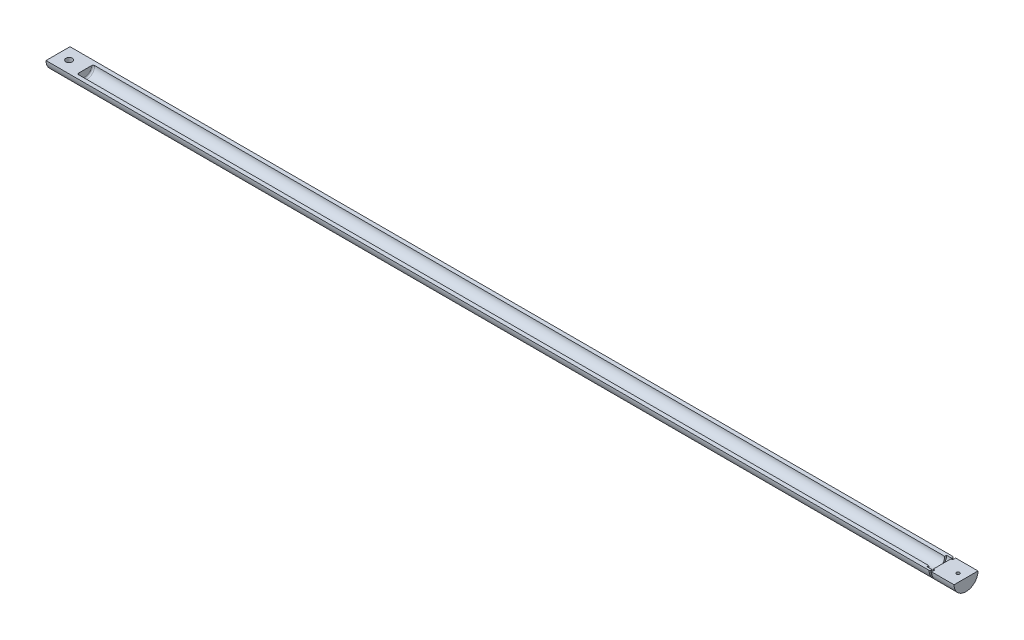
from build123d import *

# Parameters (mm, degrees)
SKETCH1_W             = 1803.4
SKETCH1_H             = 57.15
WOOD_BLOCK_DEPTH      = 28.575
SKETCH2_W             = 1755.775
SKETCH2_H             = 15.875
SKETCH9_W             = 10.541
SKETCH9_H             = 19.558
SKETCH10_W            = 57.15
SKETCH10_H            = 28.575
BOSS_EXTRUDE1_DEPTH   = 53.975
FILLET1_R             = 3.175
SKETCH5_R             = 6.3881
MOUTHPIECE_HOLE_DEPTH = 21.59
SKETCH6_R             = 3.175
DOWEL_PIN_HOLE_DEPTH  = 15.24
SKETCH8_R             = 8.128
MOUNTING_HOLES_DEPTH  = 10.3124
CHAMFER1_SIZE         = 16.7386
SKETCH3_OUTSIDE_W     = 420.056
SKETCH3_OUTSIDE_H     = 391.481
SKETCH3_OUTSIDE_R     = 23.8125
OUTER_DIAMETER_DEPTH  = 1805.531577204
SKETCH7_W             = 3.175
SKETCH7_H             = 6.35
CHAMFER_AT_FOOT_SIZE  = 1.905


with BuildPart() as part:
    # Sketch1 → wood block (new body)
    with BuildSketch(Plane(origin=(0, 0, 0), x_dir=(1, 0, 0), z_dir=(0, 1, 0))):
        with Locations((901.7, 28.575)):
            Rectangle(SKETCH1_W, SKETCH1_H)
    extrude(amount=WOOD_BLOCK_DEPTH)

    # Sketch2 → inner bore (revolve, cut)
    with BuildSketch(Plane.XY.offset(-28.575)):
        with Locations((877.8875, 20.6375)):
            Rectangle(SKETCH2_W, SKETCH2_H)
    revolve(axis=Axis((1755.775, 28.575, -28.575), (-1, 0, 0)), mode=Mode.SUBTRACT)

    # Sketch9 → flanged foot relief (revolve, cut)
    with BuildSketch(Plane.XY.offset(-28.575)):
        with Locations((1750.5045, 18.796)):
            Rectangle(SKETCH9_W, SKETCH9_H)
    revolve(axis=Axis((1755.775, 28.575, -28.575), (-1, 0, 0)), mode=Mode.SUBTRACT)

    # Sketch10 → Boss-Extrude1 (add)
    with BuildSketch(Plane.ZY):
        with Locations((-28.575, 14.2875)):
            Rectangle(SKETCH10_W, SKETCH10_H)
    extrude(amount=-BOSS_EXTRUDE1_DEPTH)

    # Fillet1
    fillet1_edges = [part.edges().sort_by_distance(p)[0] for p in [
        (53.975, 12.7, -28.575),
    ]]
    fillet(fillet1_edges, radius=FILLET1_R)

    # Sketch5 → mouthpiece hole (cut)
    with BuildSketch(Plane(origin=(0, 28.575, 0), x_dir=(1, 0, 0), z_dir=(0, 1, 0))):
        with Locations((22.225, 28.575)):
            Circle(SKETCH5_R)
    extrude(amount=-MOUTHPIECE_HOLE_DEPTH, mode=Mode.SUBTRACT)

    # Sketch6 → dowel pin hole (cut)
    with BuildSketch(Plane(origin=(0, 28.575, 0), x_dir=(1, 0, 0), z_dir=(0, 1, 0))):
        with Locations((1787.525, 28.575)):
            Circle(SKETCH6_R)
    extrude(amount=-DOWEL_PIN_HOLE_DEPTH, mode=Mode.SUBTRACT)

    # Sketch8 → mounting holes (cut)
    with BuildSketch(Plane.XZ):
        with Locations((22.225, -28.575)):
            Circle(SKETCH8_R)
        with Locations((713.359, -28.575)):
            Circle(SKETCH8_R)
    extrude(amount=-MOUNTING_HOLES_DEPTH, mode=Mode.SUBTRACT)

    # Chamfer1
    chamfer1_edges = [part.edges().sort_by_distance(p)[0] for p in [
        (901.7, 0, -57.15),
        (901.7, 0, 0),
    ]]
    chamfer(chamfer1_edges, length=CHAMFER1_SIZE)

    # Sketch3 outside → outer diameter (cut, through all)
    with BuildSketch(Plane(origin=(1803.4, 0, 0), x_dir=(0, 0, -1), z_dir=(1, 0, 0))):
        with Locations((28.575, 14.2875)):
            Rectangle(SKETCH3_OUTSIDE_W, SKETCH3_OUTSIDE_H)
        with Locations((28.575, 28.575)):
            Circle(SKETCH3_OUTSIDE_R, mode=Mode.SUBTRACT)
    extrude(amount=-OUTER_DIAMETER_DEPTH, mode=Mode.SUBTRACT)

    # Sketch7 → end length locator (revolve, cut)
    with BuildSketch(Plane(origin=(0, 28.575, 0), x_dir=(1, 0, 0), z_dir=(0, 1, 0))):
        with Locations((1757.3625, 7.9375)):
            Rectangle(SKETCH7_W, SKETCH7_H)
    revolve(axis=Axis((-15.875, 28.575, -28.575), (1, 0, 0)), mode=Mode.SUBTRACT)


with BuildPart() as end_length_locator_piece_1:
    # of the separate pieces the step leaves, piece 1, a body of its own (end_length_locator_pieces)
    add(part.part.solids().sort_by_distance((0, 28.575, -4.7625))[0])

    # Chamfer at foot
    chamfer_at_foot_edges = [end_length_locator_piece_1.edges().sort_by_distance(p)[0] for p in [
        (1755.775, 4.7625, -28.575),
    ]]
    chamfer(chamfer_at_foot_edges, length=CHAMFER_AT_FOOT_SIZE)


with BuildPart() as end_length_locator_piece_2:
    # of the separate pieces the step leaves, piece 2, a body of its own (end_length_locator_pieces)
    add(part.part.solids().sort_by_distance((1803.4, 28.575, -52.3875))[0])


solid = Compound([end_length_locator_piece_1.part, end_length_locator_piece_2.part])
